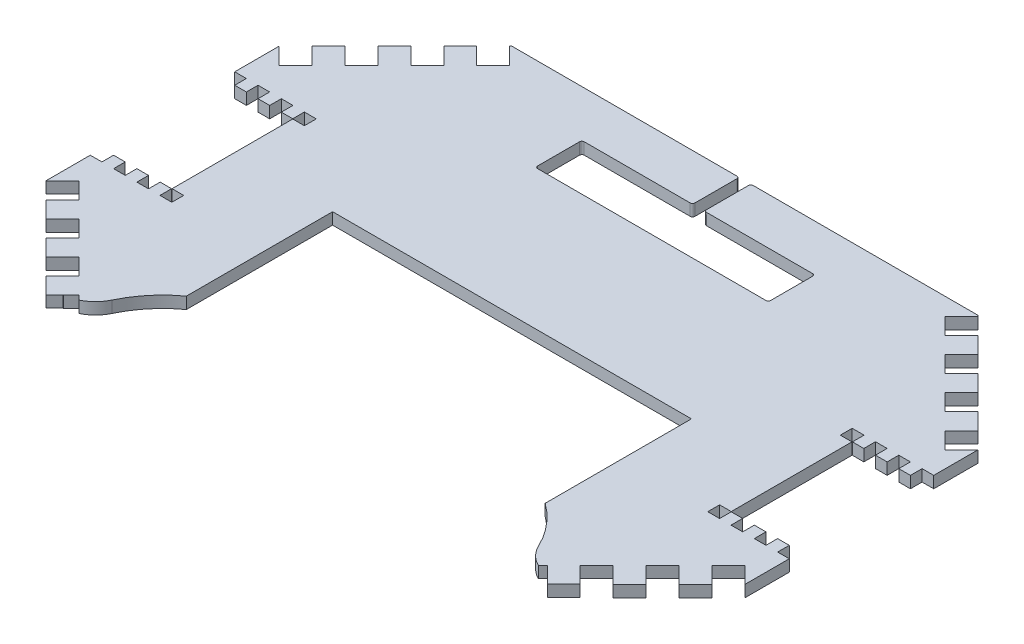
from build123d import *

# Parameters (mm, degrees)
ESQUISSE1_W                = 300
ESQUISSE1_H                = 200
BOSS_EXTRU_1_DEPTH         = 5
ENL_V_MAT_EXTRU_1_DEPTH    = 10
ESQUISSE10_R               = 46
ENL_V_MAT_EXTRU_9_DEPTH    = 10
CONG_2_R                   = 15
CONG_3_R                   = 15
ENL_V_MAT_EXTRU_10_DEPTH   = 10
R_P_TITION_LIN_AIRE1_COUNT = 4
R_P_TITION_LIN_AIRE1_PITCH = 20
SYM_TRIE3_COPY_1_DEPTH     = 10
SYM_TRIE3_COPY_2_DEPTH     = 10
SYM_TRIE3_COPY_3_DEPTH     = 10
SYM_TRIE4_COPY_1_DEPTH     = 10
SYM_TRIE4_COPY_2_DEPTH     = 10
SYM_TRIE4_COPY_3_DEPTH     = 10
SYM_TRIE4_COPY_4_DEPTH     = 10
SYM_TRIE4_COPY_5_DEPTH     = 10
SYM_TRIE4_COPY_6_DEPTH     = 10
SYM_TRIE4_COPY_7_DEPTH     = 10
ESQUISSE16_W               = 154
ESQUISSE16_H               = 100
ENL_V_MAT_EXTRU_15_DEPTH   = 10
ESQUISSE24_W               = 30
ESQUISSE24_H               = 52
ENL_V_MAT_EXTRU_18_DEPTH   = 10
ESQUISSE25_W               = 5.1
ESQUISSE25_H               = 5.1
ESQUISSE25_W_2             = 5
ENL_V_MAT_EXTRU_21_DEPTH   = 10
ESQUISSE26_W               = 100
ESQUISSE26_H               = 20
ENL_V_MAT_EXTRU_22_DEPTH   = 10
ESQUISSE27_W               = 5
ESQUISSE27_H               = 20
ENL_V_MAT_EXTRU_23_DEPTH   = 10
CONG_4_R                   = 1
BOSS_EXTRU_2_DEPTH         = 5


with BuildPart() as part:
    # Esquisse1 → Boss.-Extru.1 (new body)
    with BuildSketch(Plane(origin=(0, 0, 0), x_dir=(1, 0, 0), z_dir=(0, 1, 0))):
        Rectangle(ESQUISSE1_W, ESQUISSE1_H)
    extrude(amount=BOSS_EXTRU_1_DEPTH)

    # Esquisse2 → Enlèv. mat.-Extru.1 (cut)
    with BuildSketch(Plane(origin=(0, 5, 0), x_dir=(1, 0, 0), z_dir=(0, 1, 0))):
        Polygon((-100, 100), (-150, 50), (-150, 100), align=None)
        Polygon((150, 100), (150, 50), (100, 100), align=None)
        Polygon((150, -100), (150, -50), (100, -100), align=None)
        Polygon((-100, -100), (-150, -100), (-150, -50), align=None)
    extrude(amount=-ENL_V_MAT_EXTRU_1_DEPTH, mode=Mode.SUBTRACT)

    # Esquisse10 → Enlèv. mat.-Extru.9 (cut)
    with BuildSketch(Plane(origin=(0, 5, 0), x_dir=(1, 0, 0), z_dir=(0, 1, 0))):
        with Locations((-50, -100)):
            Circle(ESQUISSE10_R)
    enl_v_mat_extru_9 = extrude(amount=-ENL_V_MAT_EXTRU_9_DEPTH, mode=Mode.SUBTRACT)

    # Symétrie2: Enlèv. mat.-Extru.9 across plane
    add(enl_v_mat_extru_9.mirror(Plane(origin=(0, 0, 0), x_dir=(0, 0, 1), z_dir=(1, 0, 0))), mode=Mode.SUBTRACT)

    # Congé2
    # the kernel refuses this fillet: 15 mm, written as the material it takes off along each edge
    with BuildSketch(Plane(origin=(96, -21.235602644, 100), x_dir=(-0.09232870714969725, 0, -0.9957285824139354), z_dir=(0, 1, 0))) as cong_2_piece_1:
        with BuildLine():
            CenterArc((9.879171665, -14.935928736), CONG_2_R, 95.297590138, 37.799165941)
            Line((-0.369314829, -3.98291433), (-0.574284558, -3.763854042))
            ThreePointArc((-0.574284558, -3.763854042), (-0.483375989, -1.963758553), (-0.298718575, 0.027698612))
            Line((-0.298718575, 0.027698612), (0.027698612, 0.298718575))
            ThreePointArc((0.027698612, 0.298718575), (4.247120529, 0.103514791), (8.466542446, 0.298718575))
            Line((8.466542446, 0.298718575), (8.494241058, 0))
        make_face()
    extrude(amount=47.471205289, mode=Mode.SUBTRACT)
    with BuildSketch(Plane(origin=(-4, 31.582289094, 100), x_dir=(-0.11557516997606784, 0, -0.9932987365767678), z_dir=(0, -1, 0))) as cong_2_piece_2:
        with BuildLine():
            CenterArc((12.366543187, 14.899481049), CONG_2_R, 207.615736088, 55.747462838)
            Line((-0.92460136, 7.946389893), (-1.190424251, 7.807328069))
            ThreePointArc((-1.190424251, 7.807328069), (-0.760290301, 3.938522395), (-0.297989621, -0.034672551))
            Line((-0.297989621, -0.034672551), (0.034672551, -0.297989621))
            ThreePointArc((0.034672551, -0.297989621), (5.316457819, 0.008258117), (10.598243087, -0.297989621))
            Line((10.598243087, -0.297989621), (10.632915638, 0))
        make_face()
    extrude(amount=58.164578189, mode=Mode.SUBTRACT)
    with BuildSketch(Plane(origin=(-96, -21.235602644, 100), x_dir=(-1, 0, 0), z_dir=(0, 1, 0))) as cong_2_piece_3:
        with BuildLine():
            CenterArc((13.96, -11.215988588), CONG_2_R, 131.605653784, 37.799165941)
            Line((-0.784262295, -8.457958607), (-1.079147541, -8.402798008))
            ThreePointArc((-1.079147541, -8.402798008), (-0.495203784, -4.219421917), (-0.3, 0))
            Line((-0.3, 0), (0, 0.3))
            ThreePointArc((0, 0.3), (2, 0.3), (3.8008, 0.224319772))
            Line((3.8008, 0.224319772), (4, 0))
        make_face()
    extrude(amount=47.471205289, mode=Mode.SUBTRACT)

    # Congé3
    # the kernel refuses this fillet: 15 mm, written as the material it takes off along each edge
    with BuildSketch(Plane(origin=(4, 82.454375783, 100), x_dir=(-0.5259574363156356, 0, -0.8505108906911681), z_dir=(0, -1, 0))) as cong_3_piece_1:
        with BuildLine():
            CenterArc((31.823070558, 14.976387423), CONG_3_R, 156.680733503, 110.10397256)
            Line((18.048370731, 20.91420223), (16.670900749, 21.507983711))
            ThreePointArc((16.670900749, 21.507983711), (9.495651399, 10.050239134), (-0.788936154, 1.275766336))
            Line((-0.788936154, 1.275766336), (-0.908739865, -1.193395097))
            ThreePointArc((-0.908739865, -1.193395097), (14.311759275, -3.717121073), (30.897618289, -1.497638742))
            Line((30.897618289, -1.497638742), (30.981750313, 0))
        make_face()
    extrude(amount=159.908751565, mode=Mode.SUBTRACT)
    with BuildSketch(Plane(origin=(100, 60.370568853, 100), x_dir=(-0.393687931749037, 0, -0.9192441527663723), z_dir=(0, -1, 0))) as cong_3_piece_2:
        with BuildLine():
            CenterArc((22.15656876, 14.987676404), CONG_3_R, 158.18416882, 109.493145359)
            Line((8.230821057, 20.56204192), (6.838246287, 21.119478472))
            Line((6.838246287, 21.119478472), (-1.39257477, 0.557436552))
            Line((-1.39257477, 0.557436552), (-0.638910013, -1.357127111))
            ThreePointArc((-0.638910013, -1.357127111), (9.985368841, -2.532046911), (21.487866451, -1.49876764))
            Line((21.487866451, -1.49876764), (21.54865757, 0))
        make_face()
    extrude(amount=115.741137706, mode=Mode.SUBTRACT)
    with BuildSketch(Plane(origin=(-100, 60.370568853, 100), x_dir=(-0.7071067811865478, 0, -0.7071067811865471), z_dir=(0, -1, 0))) as cong_3_piece_3:
        with BuildLine():
            CenterArc((22.148227541, 15), CONG_3_R, 160.506854641, 109.493145359)
            Line((8.008006246, 20.005411244), (6.593984116, 20.505952369))
            ThreePointArc((6.593984116, 20.505952369), (1.360096619, 10.211218813), (-1.497368513, -0.088811805))
            Line((-1.497368513, -0.088811805), (0, -1.5))
            Line((0, -1.5), (22.148227541, -1.5))
            Line((22.148227541, -1.5), (22.148227541, 0))
        make_face()
    extrude(amount=115.741137706, mode=Mode.SUBTRACT)

    # Esquisse11 → Enlèv. mat.-Extru.10 (cut)
    with BuildSketch(Plane(origin=(0, 5, 0), x_dir=(1, 0, 0), z_dir=(0, 1, 0))):
        Polygon((-150, 50), (-142.928932188, 57.071067812), (-135.857864376, 50), (-142.928932188, 42.928932188), align=None)
    enl_v_mat_extru_10 = extrude(amount=-ENL_V_MAT_EXTRU_10_DEPTH, mode=Mode.SUBTRACT)

    # Répétition linéaire1: Enlèv. mat.-Extru.10 ×4
    with Locations(*[Vector(0.7071067811865476, 0, -0.7071067811865476) * (i * R_P_TITION_LIN_AIRE1_PITCH) for i in range(1, R_P_TITION_LIN_AIRE1_COUNT)]):
        add(enl_v_mat_extru_10, mode=Mode.SUBTRACT)

    # Symétrie3: Enlèv. mat.-Extru.10 across plane
    add(enl_v_mat_extru_10.mirror(Plane.XY), mode=Mode.SUBTRACT)

    # Symétrie3 copy 1 sketch → Symétrie3 copy 1 (cut)
    with BuildSketch(Plane(origin=(14.142135624, 5, 14.142135624), x_dir=(1, 0, 0), z_dir=(0, 1, 0))):
        Polygon((-150, -50), (-142.928932188, -57.071067812), (-135.857864376, -50), (-142.928932188, -42.928932188), align=None)
    extrude(amount=-SYM_TRIE3_COPY_1_DEPTH, mode=Mode.SUBTRACT)

    # Symétrie3 copy 2 sketch → Symétrie3 copy 2 (cut)
    with BuildSketch(Plane(origin=(28.284271247, 5, 28.284271247), x_dir=(1, 0, 0), z_dir=(0, 1, 0))):
        Polygon((-150, -50), (-142.928932188, -57.071067812), (-135.857864376, -50), (-142.928932188, -42.928932188), align=None)
    extrude(amount=-SYM_TRIE3_COPY_2_DEPTH, mode=Mode.SUBTRACT)

    # Symétrie3 copy 3 sketch → Symétrie3 copy 3 (cut)
    with BuildSketch(Plane(origin=(42.426406871, 5, 42.426406871), x_dir=(1, 0, 0), z_dir=(0, 1, 0))):
        Polygon((-150, -50), (-142.928932188, -57.071067812), (-135.857864376, -50), (-142.928932188, -42.928932188), align=None)
    extrude(amount=-SYM_TRIE3_COPY_3_DEPTH, mode=Mode.SUBTRACT)

    # Symétrie4: Enlèv. mat.-Extru.10 across plane
    add(enl_v_mat_extru_10.mirror(Plane(origin=(0, 0, 0), x_dir=(0, 0, 1), z_dir=(1, 0, 0))), mode=Mode.SUBTRACT)

    # Symétrie4 copy 1 sketch → Symétrie4 copy 1 (cut)
    with BuildSketch(Plane(origin=(-14.142135624, 5, -14.142135624), x_dir=(-1, 0, 0), z_dir=(0, 1, 0))):
        Polygon((-150, -50), (-142.928932188, -57.071067812), (-135.857864376, -50), (-142.928932188, -42.928932188), align=None)
    extrude(amount=-SYM_TRIE4_COPY_1_DEPTH, mode=Mode.SUBTRACT)

    # Symétrie4 copy 2 sketch → Symétrie4 copy 2 (cut)
    with BuildSketch(Plane(origin=(-28.284271247, 5, -28.284271247), x_dir=(-1, 0, 0), z_dir=(0, 1, 0))):
        Polygon((-150, -50), (-142.928932188, -57.071067812), (-135.857864376, -50), (-142.928932188, -42.928932188), align=None)
    extrude(amount=-SYM_TRIE4_COPY_2_DEPTH, mode=Mode.SUBTRACT)

    # Symétrie4 copy 3 sketch → Symétrie4 copy 3 (cut)
    with BuildSketch(Plane(origin=(-42.426406871, 5, -42.426406871), x_dir=(-1, 0, 0), z_dir=(0, 1, 0))):
        Polygon((-150, -50), (-142.928932188, -57.071067812), (-135.857864376, -50), (-142.928932188, -42.928932188), align=None)
    extrude(amount=-SYM_TRIE4_COPY_3_DEPTH, mode=Mode.SUBTRACT)

    # Symétrie4 copy 4 sketch → Symétrie4 copy 4 (cut)
    with BuildSketch(Plane(origin=(0, 5, 0), x_dir=(-1, 0, 0), z_dir=(0, 1, 0))):
        Polygon((-150, 50), (-142.928932188, 57.071067812), (-135.857864376, 50), (-142.928932188, 42.928932188), align=None)
    extrude(amount=-SYM_TRIE4_COPY_4_DEPTH, mode=Mode.SUBTRACT)

    # Symétrie4 copy 5 sketch → Symétrie4 copy 5 (cut)
    with BuildSketch(Plane(origin=(-14.142135624, 5, 14.142135624), x_dir=(-1, 0, 0), z_dir=(0, 1, 0))):
        Polygon((-150, 50), (-142.928932188, 57.071067812), (-135.857864376, 50), (-142.928932188, 42.928932188), align=None)
    extrude(amount=-SYM_TRIE4_COPY_5_DEPTH, mode=Mode.SUBTRACT)

    # Symétrie4 copy 6 sketch → Symétrie4 copy 6 (cut)
    with BuildSketch(Plane(origin=(-28.284271247, 5, 28.284271247), x_dir=(-1, 0, 0), z_dir=(0, 1, 0))):
        Polygon((-150, 50), (-142.928932188, 57.071067812), (-135.857864376, 50), (-142.928932188, 42.928932188), align=None)
    extrude(amount=-SYM_TRIE4_COPY_6_DEPTH, mode=Mode.SUBTRACT)

    # Symétrie4 copy 7 sketch → Symétrie4 copy 7 (cut)
    with BuildSketch(Plane(origin=(-42.426406871, 5, 42.426406871), x_dir=(-1, 0, 0), z_dir=(0, 1, 0))):
        Polygon((-150, 50), (-142.928932188, 57.071067812), (-135.857864376, 50), (-142.928932188, 42.928932188), align=None)
    extrude(amount=-SYM_TRIE4_COPY_7_DEPTH, mode=Mode.SUBTRACT)

    # Esquisse16 → Enlèv. mat.-Extru.15 (cut)
    with BuildSketch(Plane(origin=(0, 5, 0), x_dir=(1, 0, 0), z_dir=(0, 1, 0))):
        with Locations((0, -50)):
            Rectangle(ESQUISSE16_W, ESQUISSE16_H)
    extrude(amount=-ENL_V_MAT_EXTRU_15_DEPTH, mode=Mode.SUBTRACT)

    # Esquisse24 → Enlèv. mat.-Extru.18 (cut)
    with BuildSketch(Plane(origin=(0, 5, 0), x_dir=(1, 0, 0), z_dir=(0, 1, 0))):
        with Locations((-135, 0)):
            Rectangle(ESQUISSE24_W, ESQUISSE24_H)
        with Locations((135, 0)):
            Rectangle(ESQUISSE24_W, ESQUISSE24_H)
    extrude(amount=-ENL_V_MAT_EXTRU_18_DEPTH, mode=Mode.SUBTRACT)

    # Esquisse25 → Enlèv. mat.-Extru.21 (cut)
    with BuildSketch(Plane(origin=(0, 5, 0), x_dir=(1, 0, 0), z_dir=(0, 1, 0))):
        with Locations((-147.55, 28.45)):
            Rectangle(ESQUISSE25_W, ESQUISSE25_H)
        with Locations((-127.5, 28.45)):
            Rectangle(ESQUISSE25_W_2, ESQUISSE25_H)
        with Locations((-137.5, 28.45)):
            Rectangle(ESQUISSE25_W_2, ESQUISSE25_H)
        with Locations((-117.55, 28.45)):
            Rectangle(ESQUISSE25_W, ESQUISSE25_H)
        with Locations((-117.55, -28.45)):
            Rectangle(ESQUISSE25_W, ESQUISSE25_H)
        with Locations((-127.5, -28.45)):
            Rectangle(ESQUISSE25_W_2, ESQUISSE25_H)
        with Locations((-137.5, -28.45)):
            Rectangle(ESQUISSE25_W_2, ESQUISSE25_H)
        with Locations((-147.55, -28.45)):
            Rectangle(ESQUISSE25_W, ESQUISSE25_H)
        with Locations((147.55, -28.45)):
            Rectangle(ESQUISSE25_W, ESQUISSE25_H)
        with Locations((127.5, -28.45)):
            Rectangle(ESQUISSE25_W_2, ESQUISSE25_H)
        with Locations((137.5, -28.45)):
            Rectangle(ESQUISSE25_W_2, ESQUISSE25_H)
        with Locations((117.55, -28.45)):
            Rectangle(ESQUISSE25_W, ESQUISSE25_H)
        with Locations((117.55, 28.45)):
            Rectangle(ESQUISSE25_W, ESQUISSE25_H)
        with Locations((127.5, 28.45)):
            Rectangle(ESQUISSE25_W_2, ESQUISSE25_H)
        with Locations((137.5, 28.45)):
            Rectangle(ESQUISSE25_W_2, ESQUISSE25_H)
        with Locations((147.55, 28.45)):
            Rectangle(ESQUISSE25_W, ESQUISSE25_H)
    extrude(amount=-ENL_V_MAT_EXTRU_21_DEPTH, mode=Mode.SUBTRACT)

    # Esquisse26 → Enlèv. mat.-Extru.22 (cut)
    with BuildSketch(Plane(origin=(0, 5, 0), x_dir=(1, 0, 0), z_dir=(0, 1, 0))):
        with Locations((0, 70)):
            Rectangle(ESQUISSE26_W, ESQUISSE26_H)
    extrude(amount=-ENL_V_MAT_EXTRU_22_DEPTH, mode=Mode.SUBTRACT)

    # Esquisse27 → Enlèv. mat.-Extru.23 (cut)
    with BuildSketch(Plane(origin=(0, 5, 0), x_dir=(1, 0, 0), z_dir=(0, 1, 0))):
        with Locations((0, 90)):
            Rectangle(ESQUISSE27_W, ESQUISSE27_H)
    extrude(amount=-ENL_V_MAT_EXTRU_23_DEPTH, mode=Mode.SUBTRACT)

    # Congé4
    cong_4_edges = [part.edges().sort_by_distance(p)[0] for p in [
        (-50, 2.5, -60),
        (-50, 2.5, -80),
        (50, 2.5, -80),
        (50, 2.5, -60),
        (-2.5, 2.5, -80),
        (2.5, 2.5, -80),
        (-2.5, 2.5, -100),
        (2.5, 2.5, -100),
    ]]
    fillet(cong_4_edges, radius=CONG_4_R)

    # Esquisse28 → Boss.-Extru.2 (add)
    with BuildSketch(Plane(origin=(0, 5, 0), x_dir=(1, 0, 0), z_dir=(0, 1, 0))):
        Polygon((107.573593129, -78.284271247), (114.595839569, -85.306517687), (107.573593129, -92.328764127), (100.551346689, -85.306517687), align=None)
        Polygon((-107.573593129, -92.328764127), (-114.595839569, -85.306517687), (-107.573593129, -78.284271247), (-100.551346689, -85.306517687), align=None)
    extrude(amount=-BOSS_EXTRU_2_DEPTH)


solid = part.part
